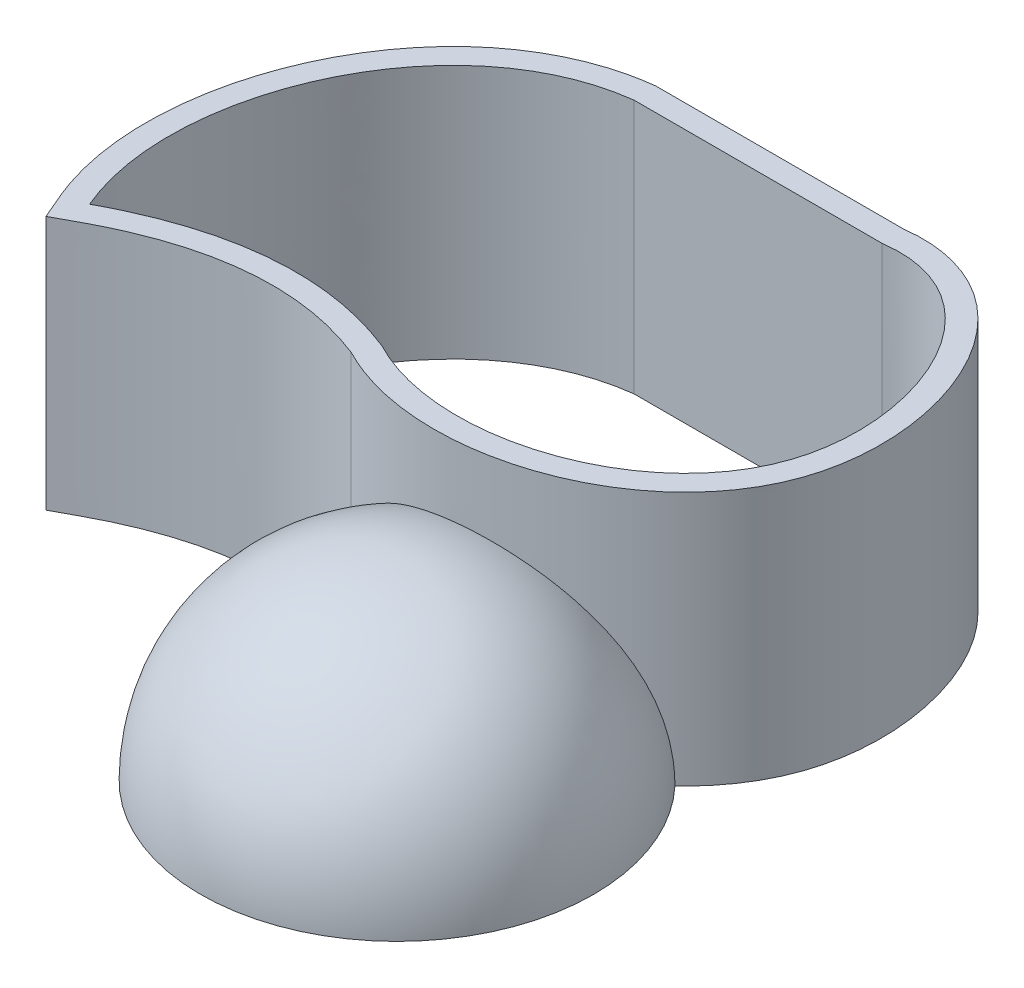
from build123d import *

# Parameters (mm, degrees)
EXTRUDE_START   = -33
EXTRUDE_2_DEPTH = 33


# Read off the part's stored shape, not the designer's step: 돌출-얇게2
with BuildPart() as part:
    # 스케치2 → 회전7 (revolve)
    with BuildSketch(Plane.XY):
        with BuildLine():
            Line((22.5, 0), (25.5, 0))
            ThreePointArc((25.5, 0), (18.03122292, 18.03122292), (0, 25.5))
            Line((0, 25.5), (0, 22.5))
            ThreePointArc((0, 22.5), (15.909902577, 15.909902577), (22.5, 0))
        make_face()
    revolve(axis=Axis((0, 0, 0), (0, 1, 0)))

    # 돌출-얇게2 outline → 돌출-얇게2 (add)
    with BuildSketch(Plane.XZ.offset(EXTRUDE_START)):
        with BuildLine():
            add(Edge.make_bspline(
                [(3.839233032, -61.846078826), (4.875378774, -61.98017436), (5.908551628, -62.027635761), (7.453601497, -61.961588996), (7.967831729, -61.916656889), (8.994654709, -61.779074073), (9.509737601, -61.685812438), (11.033497044, -61.335317545), (12.013183113, -61.010537704), (13.431543666, -60.394409601), (13.895775616, -60.167472942), (14.807337422, -59.671001858), (15.256330451, -59.400215741), (16.5569226, -58.538870572), (17.367897111, -57.897445665), (18.510062523, -56.846297742), (18.878341611, -56.481008136), (19.591034412, -55.721837074), (19.934590528, -55.328667156), (20.917572109, -54.125303951), (21.51462582, -53.286188481), (22.607109769, -51.543647141), (23.102453288, -50.640166392), (23.774674576, -49.240144694), (23.987430356, -48.764655983), (24.386785221, -47.805847339), (24.573196369, -47.323222426), (25.094600027, -45.866163929), (25.391955132, -44.882593295), (25.891366714, -42.892316838), (26.093406037, -41.88560685), (26.324322372, -40.358028145), (26.389225556, -39.845905327), (26.494211205, -38.815634087), (26.534339244, -38.295987158), (26.669162164, -35.70732051), (26.572600162, -33.659567089), (26.083433627, -30.626980941), (25.86225338, -29.622709847), (25.429240714, -28.127783404), (25.267018798, -27.629561325), (24.912301424, -26.653464877), (24.719628961, -26.174068213), (23.68222193, -23.818916648), (22.617466597, -22.067463068), (21.01107373, -20.033761573), (20.674742151, -19.63366872), (19.982474533, -18.858168923), (19.626135578, -18.482073471), (18.527978331, -17.387065923), (17.757113218, -16.701325782), (16.143166263, -15.412318212), (15.298025457, -14.807771267), (13.54678977, -13.683995918), (12.649062144, -13.169781971), (9.894734304, -11.758982594), (7.976002549, -10.992111253), (3.990585243, -9.794632525), (1.972853682, -9.378391642), (-1.089865488, -9.017476048), (-2.116853224, -8.941523661), (-4.183497134, -8.88201305), (-5.228532643, -8.899041512), (-8.325555991, -9.095056009), (-10.349397293, -9.414824924), (-13.318968466, -10.200940118), (-14.297703176, -10.514474732), (-16.230791142, -11.254429551), (-17.187388743, -11.682559046), (-18.113408841, -12.164964087)],
                knots=[0, 0, 0, 0, 0.03125, 0.03125, 0.046875, 0.046875, 0.0625, 0.0625, 0.09375, 0.09375, 0.109375, 0.109375, 0.125, 0.125, 0.15625, 0.15625, 0.171875, 0.171875, 0.1875, 0.1875, 0.21875, 0.21875, 0.25, 0.25, 0.265625, 0.265625, 0.28125, 0.28125, 0.3125, 0.3125, 0.34375, 0.34375, 0.359375, 0.359375, 0.375, 0.375, 0.4375, 0.4375, 0.46875, 0.46875, 0.484375, 0.484375, 0.5, 0.5, 0.5625, 0.5625, 0.578125, 0.578125, 0.59375, 0.59375, 0.625, 0.625, 0.65625, 0.65625, 0.6875, 0.6875, 0.75, 0.75, 0.8125, 0.8125, 0.84375, 0.84375, 0.875, 0.875, 0.9375, 0.9375, 0.96875, 0.96875, 1, 1, 1, 1], degree=3))
            add(Edge.make_bspline(
                [(-18.113408841, -12.164964087), (-19.552024519, -12.72862798), (-21.013940441, -13.201979246), (-23.244566906, -13.765675717), (-23.994403862, -13.929175658), (-25.507164288, -14.205451711), (-26.272303062, -14.318454427), (-30.105178218, -14.748880756), (-33.152611253, -14.660564265), (-36.940598588, -14.061629155), (-37.699432246, -13.916880749), (-39.203638846, -13.582438535), (-39.946856126, -13.393415181), (-42.152071999, -12.766390388), (-43.589711133, -12.268621928), (-46.409655166, -11.13732), (-47.791935838, -10.503727088), (-49.829443532, -9.465222806), (-50.500890335, -9.100107389), (-51.845809142, -8.374845478), (-52.518268546, -8.012214522), (-53.190727949, -7.649583566)],
                knots=[0, 0, 0, 0, 0.125, 0.125, 0.1875, 0.1875, 0.25, 0.25, 0.5, 0.5, 0.5625, 0.5625, 0.625, 0.625, 0.75, 0.75, 0.875, 0.875, 0.9375, 0.9375, 1, 1, 1, 1], degree=3))
            add(Edge.make_bspline(
                [(-53.190727949, -7.649583566), (-53.474761336, -8.310293753), (-53.758794723, -8.971003941), (-54.326861497, -10.292424315), (-54.617221905, -10.951388333), (-55.400404537, -12.95253917), (-55.82881912, -14.312501596), (-56.515491885, -17.079387236), (-56.773681276, -18.486329434), (-57.03917668, -20.630354705), (-57.107348067, -21.351222505), (-57.203019086, -22.801782049), (-57.23011017, -23.524630961), (-57.252622881, -25.686292061), (-57.18955959, -27.118250908), (-56.918016009, -29.965128447), (-56.709490123, -31.380041796), (-56.149229613, -34.193087104), (-55.797099, -35.592567874), (-54.945621302, -38.368573572), (-54.453127292, -39.723188037), (-53.336163716, -42.366407833), (-52.71169807, -43.655015124), (-51.325129003, -46.163388545), (-50.563091174, -47.383187482), (-49.306489849, -49.156095222), (-48.867741839, -49.738437128), (-47.962181104, -50.867896606), (-47.494144871, -51.416875294), (-46.043312872, -53.015571487), (-45.014004533, -54.017266684), (-43.369557622, -55.416063491), (-42.804611169, -55.864986388), (-41.639205863, -56.726167098), (-41.036446249, -57.139706274), (-39.201258181, -58.303502275), (-37.93575128, -58.982685554), (-35.320002846, -60.146223152), (-33.969760595, -60.630575818), (-31.878171561, -61.204833238), (-31.167652736, -61.371202307), (-30.094860613, -61.579556457), (-29.736115332, -61.64219203), (-29.016349743, -61.753954968), (-28.65504457, -61.801390915), (-28.293276577, -61.846078826)],
                knots=[0, 0, 0, 0, 0.03125, 0.03125, 0.0625, 0.0625, 0.125, 0.125, 0.1875, 0.1875, 0.21875, 0.21875, 0.25, 0.25, 0.3125, 0.3125, 0.375, 0.375, 0.4375, 0.4375, 0.5, 0.5, 0.5625, 0.5625, 0.625, 0.625, 0.65625, 0.65625, 0.6875, 0.6875, 0.75, 0.75, 0.78125, 0.78125, 0.8125, 0.8125, 0.875, 0.875, 0.9375, 0.9375, 0.96875, 0.96875, 0.984375, 0.984375, 1, 1, 1, 1], degree=3))
            Line((-28.293276577, -61.846078826), (3.839233032, -61.846078826))
        make_face()
        with BuildLine():
            add(Edge.make_bspline(
                [(-16.862484967, -14.896529822), (-3.134696994, -7.631308281), (35.866994406, -19.665544012), (18.667230867, -60.909486449), (4.040822686, -58.846078826)],
                knots=[0.63249591, 0.63249591, 0.63249591, 0.63249591, 1.166889752, 1.63249591, 1.63249591, 1.63249591, 1.63249591], degree=3))
            Line((4.040822686, -58.846078826), (-28.108688405, -58.846078826))
            add(Edge.make_bspline(
                [(-51.7292994, -11.846078826), (-59.394873874, -29.677514774), (-48.936688149, -56.273270257), (-28.108688405, -58.846078826)],
                knots=[0, 0, 0, 0, 1, 1, 1, 1], degree=3))
            add(Edge.make_bspline(
                [(-16.862484967, -14.896529822), (-33.6962821, -21.570577089), (-51.7292994, -11.846078826)],
                knots=[0, 0, 0, 1, 1, 1], degree=2))
        make_face(mode=Mode.SUBTRACT)
    extrude(amount=EXTRUDE_2_DEPTH)


solid = part.part
